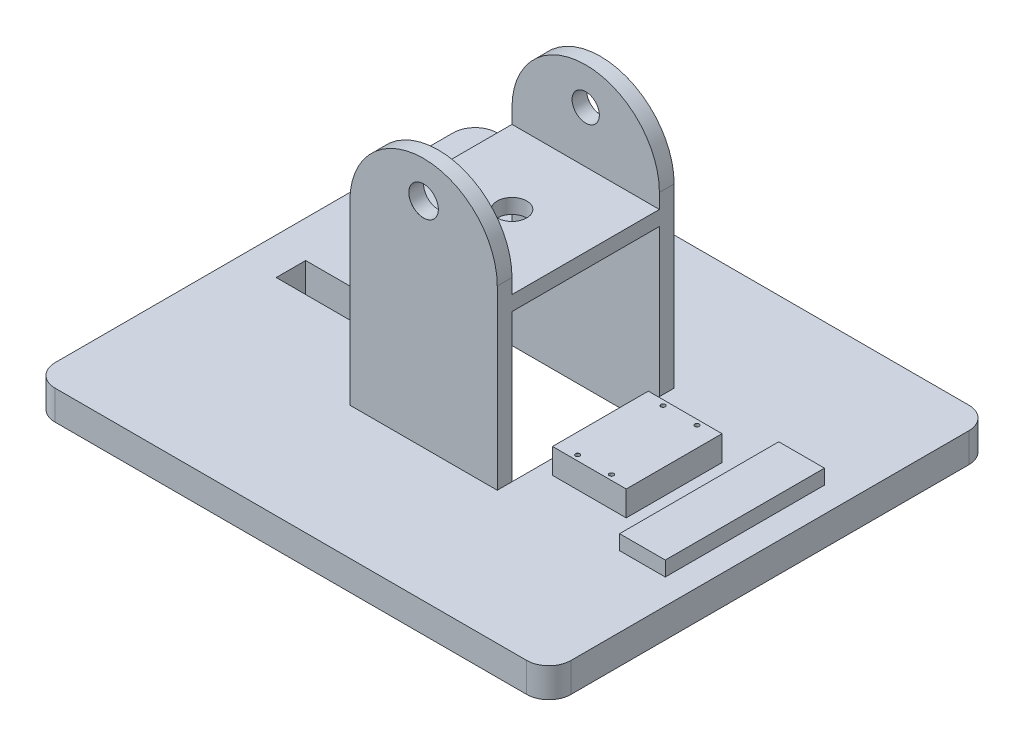
from build123d import *

# Parameters (mm, degrees)
SKETCH1_W                              = 350
SKETCH1_H                              = 300
BOSS_EXTRUDE1_DEPTH                    = 20
FILLET1_R                              = 15
SKETCH2_W                              = 100
SKETCH2_H                              = 100
CUT_EXTRUDE1_DEPTH                     = 20
BOSS_EXTRUDE2_DEPTH                    = 10
LPATTERN1_COUNT                        = 2
LPATTERN1_PITCH                        = 110
F_20_0_20_DIAMETER_HOLE2_D             = 20
F_20_0_20_DIAMETER_HOLE2_DEPTH         = 10
F_20_0_20_DIAMETER_HOLE2_CSINK_D       = 20.05
F_20_0_20_DIAMETER_HOLE2_CSINK_ANGLE   = 90
F_20_0_20_DIAMETER_HOLE2_TIP           = 6.00860619
F_18_5_18_5_DIAMETER_HOLE1_D           = 18.5
F_18_5_18_5_DIAMETER_HOLE1_DEPTH       = 10
F_18_5_18_5_DIAMETER_HOLE1_CSINK_D     = 18.55
F_18_5_18_5_DIAMETER_HOLE1_CSINK_ANGLE = 90
F_18_5_18_5_DIAMETER_HOLE1_TIP         = 5.557960726
SKETCH32_W                             = 100
SKETCH32_H                             = 10
BOSS_EXTRUDE3_DEPTH                    = 120
SKETCH37_R                             = 10
CUT_EXTRUDE2_DEPTH                     = 36.07831716
SKETCH45_W                             = 30
SKETCH45_H                             = 65
BOSS_EXTRUDE4_DEPTH                    = 17
M2_5_CLEARANCE_HOLE1_D                 = 2.9
M2_5_CLEARANCE_HOLE1_DEPTH             = 12.4
M2_5_CLEARANCE_HOLE1_CSINK_D           = 2.95
M2_5_CLEARANCE_HOLE1_CSINK_ANGLE       = 90
M2_5_CLEARANCE_HOLE1_TIP               = 0.871247898
SKETCH54_W                             = 10
SKETCH54_H                             = 65
BOSS_EXTRUDE5_DEPTH                    = 17
SKETCH55_W                             = 31
SKETCH55_H                             = 108
BOSS_EXTRUDE6_DEPTH                    = 10
SKETCH59_W                             = 80
SKETCH59_H                             = 20
CUT_EXTRUDE3_DEPTH                     = 492.324739862


with BuildPart() as part:
    # Sketch1 → Boss-Extrude1 (new body)
    with BuildSketch(Plane(origin=(0, 0, 0), x_dir=(1, 0, 0), z_dir=(0, 1, 0))):
        with Locations((175, -150)):
            Rectangle(SKETCH1_W, SKETCH1_H)
    extrude(amount=BOSS_EXTRUDE1_DEPTH)

    # Fillet1
    fillet1_edges = [part.edges().sort_by_distance(p)[0] for p in [
        (350, 10, 0),
        (0, 10, 0),
        (0, 10, 300),
        (350, 10, 300),
    ]]
    fillet(fillet1_edges, radius=FILLET1_R)

    # Sketch2 → Cut-Extrude1 (cut)
    with BuildSketch(Plane(origin=(0, 20, 0), x_dir=(1, 0, 0), z_dir=(0, 1, 0))):
        with Locations((175, -150)):
            Rectangle(SKETCH2_W, SKETCH2_H)
    extrude(amount=-CUT_EXTRUDE1_DEPTH, mode=Mode.SUBTRACT)

    # Sketch6 → Boss-Extrude2 (add)
    with BuildSketch(Plane.XY.offset(100)):
        with BuildLine():
            Line((125, 0), (125, 140))
            ThreePointArc((125, 140), (175, 190), (225, 140))
            Line((225, 140), (225, 0))
            Line((225, 0), (125, 0))
        make_face()
    boss_extrude2 = extrude(amount=-BOSS_EXTRUDE2_DEPTH)

    # LPattern1: Boss-Extrude2 ×2
    with Locations(*[(0, 0, i * LPATTERN1_PITCH) for i in range(1, LPATTERN1_COUNT)]):
        add(boss_extrude2)

    # Ø20.0 (20) Diameter Hole2
    with Locations(Plane.XY.offset(210)):
        with Locations((175, 165)):
            CounterSinkHole(F_20_0_20_DIAMETER_HOLE2_D / 2, F_20_0_20_DIAMETER_HOLE2_CSINK_D / 2, depth=F_20_0_20_DIAMETER_HOLE2_DEPTH, counter_sink_angle=F_20_0_20_DIAMETER_HOLE2_CSINK_ANGLE)
            with Locations((0, 0, -(F_20_0_20_DIAMETER_HOLE2_DEPTH + F_20_0_20_DIAMETER_HOLE2_TIP / 2))):  # 118° drill point
                Cone(0, F_20_0_20_DIAMETER_HOLE2_D / 2, F_20_0_20_DIAMETER_HOLE2_TIP, mode=Mode.SUBTRACT)

    # Ø18.5 (18.5) Diameter Hole1
    with Locations(Plane(origin=(0, 0, 90), x_dir=(-1, 0, 0), z_dir=(0, 0, -1))):
        with Locations((-175, 165)):
            CounterSinkHole(F_18_5_18_5_DIAMETER_HOLE1_D / 2, F_18_5_18_5_DIAMETER_HOLE1_CSINK_D / 2, depth=F_18_5_18_5_DIAMETER_HOLE1_DEPTH, counter_sink_angle=F_18_5_18_5_DIAMETER_HOLE1_CSINK_ANGLE)
            with Locations((0, 0, -(F_18_5_18_5_DIAMETER_HOLE1_DEPTH + F_18_5_18_5_DIAMETER_HOLE1_TIP / 2))):  # 118° drill point
                Cone(0, F_18_5_18_5_DIAMETER_HOLE1_D / 2, F_18_5_18_5_DIAMETER_HOLE1_TIP, mode=Mode.SUBTRACT)

    # Sketch32 → Boss-Extrude3 (add)
    with BuildSketch(Plane.XY.offset(210)):
        with Locations((175, 125)):
            Rectangle(SKETCH32_W, SKETCH32_H)
    extrude(amount=-BOSS_EXTRUDE3_DEPTH)

    # Sketch37 → Cut-Extrude2 (cut)
    with BuildSketch(Plane(origin=(0, 130, 0), x_dir=(1, 0, 0), z_dir=(0, 1, 0))):
        with Locations((175, -150)):
            Circle(SKETCH37_R)
    extrude(amount=-CUT_EXTRUDE2_DEPTH, mode=Mode.SUBTRACT)

    # Sketch45 → Boss-Extrude4 (add)
    with BuildSketch(Plane(origin=(0, 20, 0), x_dir=(1, 0, 0), z_dir=(0, 1, 0))):
        with Locations((260, -150)):
            Rectangle(SKETCH45_W, SKETCH45_H)
    extrude(amount=BOSS_EXTRUDE4_DEPTH)

    # M2.5 Clearance Hole1
    with Locations(Plane(origin=(0, 37, 0), x_dir=(1, 0, 0), z_dir=(0, 1, 0))):
        with Locations((248.5, -121), (271.5, -121), (271.5, -179), (248.5, -179)):
            CounterSinkHole(M2_5_CLEARANCE_HOLE1_D / 2, M2_5_CLEARANCE_HOLE1_CSINK_D / 2, depth=M2_5_CLEARANCE_HOLE1_DEPTH, counter_sink_angle=M2_5_CLEARANCE_HOLE1_CSINK_ANGLE)
            with Locations((0, 0, -(M2_5_CLEARANCE_HOLE1_DEPTH + M2_5_CLEARANCE_HOLE1_TIP / 2))):  # 118° drill point
                Cone(0, M2_5_CLEARANCE_HOLE1_D / 2, M2_5_CLEARANCE_HOLE1_TIP, mode=Mode.SUBTRACT)

    # Sketch54 → Boss-Extrude5 (add)
    with BuildSketch(Plane(origin=(0, 20, 0), x_dir=(1, 0, 0), z_dir=(0, 1, 0))):
        with Locations((280, -150)):
            Rectangle(SKETCH54_W, SKETCH54_H)
        with Locations((240, -150)):
            Rectangle(SKETCH54_W, SKETCH54_H)
    extrude(amount=BOSS_EXTRUDE5_DEPTH)

    # Sketch55 → Boss-Extrude6 (add)
    with BuildSketch(Plane(origin=(0, 20, 0), x_dir=(1, 0, 0), z_dir=(0, 1, 0))):
        with Locations((317.5, -150)):
            Rectangle(SKETCH55_W, SKETCH55_H)
    extrude(amount=BOSS_EXTRUDE6_DEPTH)

    # Sketch59 → Cut-Extrude3 (cut, through all)
    with BuildSketch(Plane(origin=(0, 20, 0), x_dir=(1, 0, 0), z_dir=(0, 1, 0))):
        with Locations((65, -150)):
            Rectangle(SKETCH59_W, SKETCH59_H)
    extrude(amount=-CUT_EXTRUDE3_DEPTH, mode=Mode.SUBTRACT)


solid = part.part
